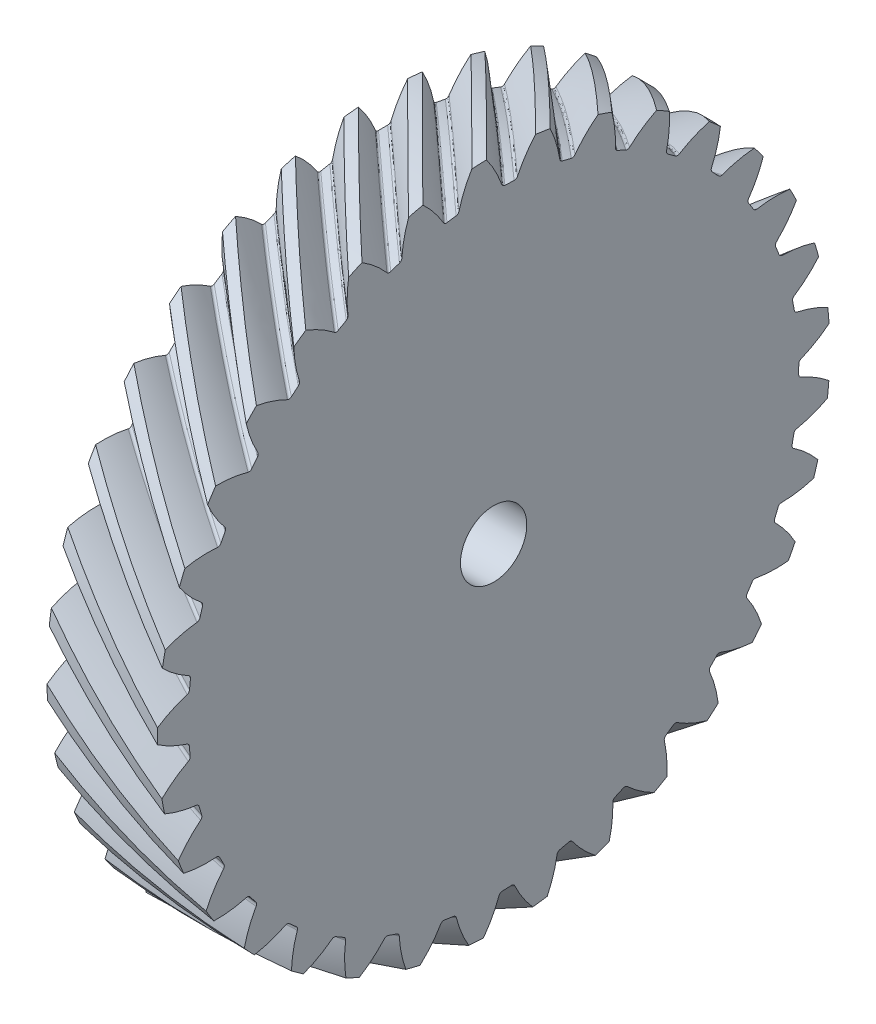
from build123d import *

# Parameters (mm, degrees)
BASPROSKE_W            = 10
BASPROSKE_H            = 30.418154724
TOOTHCUTRH_PITCH       = 191.122902833
TOOTHCUTRH_HEIGHT      = 10
TOOTHCUTRH_RADIUS      = 30.418154724
TOOTHCUTRH_START_ANGLE = -90
TEETHCUTSRH_COUNT      = 33
TEETHCUTSRH_ANGLE      = 349.090909091
BORSKE_R               = 3
BORE_DEPTH             = 62.5000025


with BuildPart() as part:
    # BasProSke → Base-Revolve (revolve)
    with BuildSketch(Plane(origin=(0, 0, 0), x_dir=(1, 0, 0), z_dir=(0, 1, 0)), mode=Mode.PRIVATE) as base_revolve_sk:
        with Locations((5, 15.209077362)):
            Rectangle(BASPROSKE_W, BASPROSKE_H)
    revolve(base_revolve_sk.sketch.rotate(Axis((-10, 0, 0), (1, 0, 0)), 180), axis=Axis((-10, 0, 0), (1, 0, 0)))

    # ToothCutRH: sweep along a helix
    with BuildLine() as toothcutrh_path:
        add(Helix(TOOTHCUTRH_PITCH, TOOTHCUTRH_HEIGHT, TOOTHCUTRH_RADIUS, center=(0, 0, 0), direction=(1, 0, 0), mode=Mode.PRIVATE).rotate(Axis((0, 0, 0), (1, 0, 0)), TOOTHCUTRH_START_ANGLE))
    # TooCutSkeRH → ToothCutRH (sweep, cut)
    with BuildSketch(Plane(origin=(0, 0, 0), x_dir=(0, 0, -1), z_dir=(1, 0, 0))):
        with BuildLine():
            ThreePointArc((0.417002229, 27.602504993), (0, 27.605654724), (-0.417002229, 27.602504993))
            ThreePointArc((-0.417002229, 27.602504993), (-0.59368454, 27.65383073), (-0.711143929, 27.795443802))
            ThreePointArc((-0.711143929, 27.795443802), (-1.687250876, 29.605792484), (-3.003202227, 31.18643133))
            ThreePointArc((-3.003202227, 31.18643133), (0, 31.330699366), (3.003202227, 31.18643133))
            ThreePointArc((3.003202227, 31.18643133), (1.687250876, 29.605792484), (0.711143929, 27.795443802))
            ThreePointArc((0.711143929, 27.795443802), (0.59368454, 27.65383073), (0.417002229, 27.602504993))
        make_face()
    toothcutrh = sweep(path=toothcutrh_path.line, is_frenet=True, mode=Mode.SUBTRACT)

    # TeethCutsRH: ToothCutRH ×33 about axis
    teethcutsrh_axis = Axis((-10, 0, 0), (1, 0, 0))
    for i in range(1, TEETHCUTSRH_COUNT):
        add(toothcutrh.rotate(teethcutsrh_axis, i * TEETHCUTSRH_ANGLE / (TEETHCUTSRH_COUNT - 1)), mode=Mode.SUBTRACT)

    # BorSke → Bore (cut, symmetric)
    with BuildSketch(Plane(origin=(0, 0, 0), x_dir=(0, 0, -1), z_dir=(1, 0, 0))):
        with Locations(Location((0, 0, 0), (0, 0, 180))):
            Circle(BORSKE_R)
    extrude(amount=BORE_DEPTH, both=True, mode=Mode.SUBTRACT)


solid = part.part
